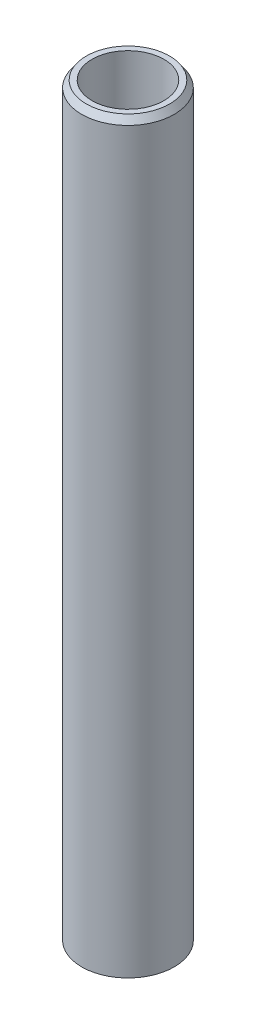
from build123d import *
from OCP.BRepFilletAPI import BRepFilletAPI_MakeChamfer

# Parameters (mm, degrees)
SKETCH1_R           = 22.5
BOSS_EXTRUDE1_DEPTH = 364.709654911
SKETCH2_R           = 17.478467206
CUT_EXTRUDE1_DEPTH  = 367.09511385
CHAMFER1_SIZE       = 3.254094536
CHAMFER1_SIZE2      = 2.254009735


with BuildPart() as part:
    # Sketch1 → Boss-Extrude1 (new body)
    with BuildSketch(Plane(origin=(0, 0, 0), x_dir=(1, 0, 0), z_dir=(0, 1, 0))):
        Circle(SKETCH1_R)
    extrude(amount=BOSS_EXTRUDE1_DEPTH)

    # Sketch2 → Cut-Extrude1 (cut, through all)
    with BuildSketch(Plane(origin=(0, 0, 0), x_dir=(1, 0, 0), z_dir=(0, 1, 0))):
        Circle(SKETCH2_R)
    extrude(amount=CUT_EXTRUDE1_DEPTH, mode=Mode.SUBTRACT)

    # Chamfer1: one chamfer whose edges measure the first distance from different faces: ONE call of the kernel's chamfer builder (chamfer() names one face for all edges)
    chamfer1_edges_1 = [part.edges().sort_by_distance(p)[0] for p in [
        (-22.5, 364.709654911, 0),
    ]]
    chamfer1_side_1 = [part.faces().sort_by_distance(p)[0] for p in [
        (-22.5, 182.354827455, 0),
    ]]
    chamfer1_edges_2 = [part.edges().sort_by_distance(p)[0] for p in [
        (-22.5, 0, 0),
    ]]
    chamfer1_side_2 = [part.faces().sort_by_distance(p)[0] for p in [
        (-21.863603897, 0, 0),
    ]]
    chamfer1 = BRepFilletAPI_MakeChamfer(part.part.solid().wrapped)
    for e in chamfer1_edges_1:
        chamfer1.Add(CHAMFER1_SIZE, CHAMFER1_SIZE2, e.wrapped, chamfer1_side_1[0].wrapped)  # the first distance lies on this face
    for e in chamfer1_edges_2:
        chamfer1.Add(CHAMFER1_SIZE, CHAMFER1_SIZE2, e.wrapped, chamfer1_side_2[0].wrapped)  # the first distance lies on this face
    add(Compound.cast(chamfer1.Shape()), mode=Mode.REPLACE)


solid = part.part
